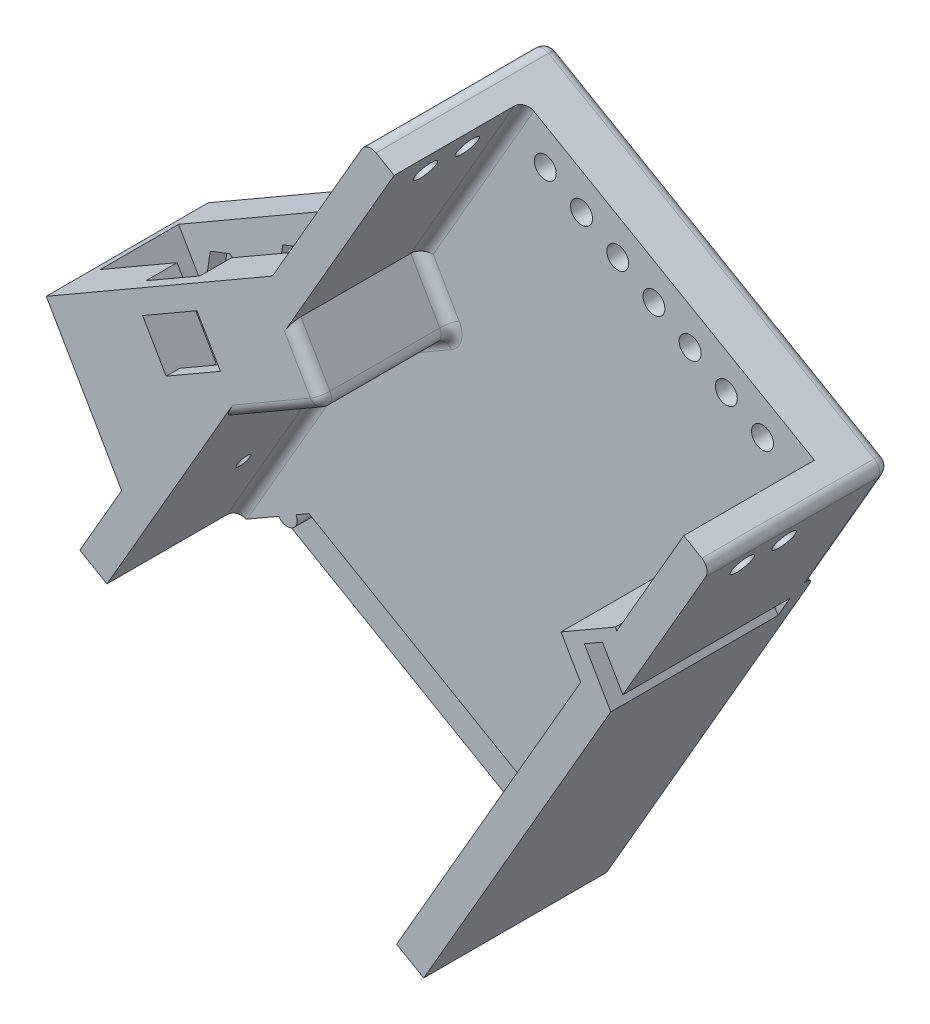
from build123d import *

# Parameters (mm, degrees)
SKETCH_2_W               = 109.92
SKETCH_2_H               = 76
EXTRUDE_1_DEPTH          = 10
CUT_EXTRUDE_1_DEPTH      = 5
SKETCH_4_R               = 2
CUT_EXTRUDE_2_DEPTH      = 92.808295873
SKETCH_5_W               = 109.92
SKETCH_5_H               = 6
EXTRUDE_2_DEPTH          = 25
CUT_EXTRUDE_3_DEPTH      = 104.340627651
CUT_EXTRUDE_3_DEPTH_BACK = 104.340627651
SKETCH_7_R               = 2.1
SKETCH_9_R               = 2.1
CUT_EXTRUDE_4_DEPTH      = 96.019804204
CUT_EXTRUDE_5_DEPTH      = 5
EXTRUDE_3_DEPTH          = 35
EXTRUDE_4_DEPTH          = 35
SKETCH_13_W              = 46
SKETCH_13_H              = 15
SKETCH_13_W_2            = 12
SKETCH_13_H_2            = 6
CUT_EXTRUDE_6_DEPTH      = 15
CUT_EXTRUDE_7_DEPTH      = 15
SKETCH_15_R              = 1.25
CUT_EXTRUDE_8_DEPTH      = 28.709519
EXTRUDE_5_DEPTH          = 35
CUT_EXTRUDE_10_DEPTH     = 4
CUT_EXTRUDE_11_REACH     = 116.42
SKETCH_22_R              = 2
CUT_EXTRUDE_12_DEPTH     = 3.5
CUT_EXTRUDE_14_REACH     = 117.568
EXTRUDE_6_DEPTH          = 3
EXTRUDE_7_REACH          = 117.568
SKETCH_27_W              = 4.526779154
SKETCH_27_H              = 4.806116501
FILLET_1_R               = 2
CUT_EXTRUDE_15_REACH     = 117.568
SKETCH_28_W              = 4.526779154
SKETCH_28_H              = 4.806116501


with BuildPart() as part:
    # 草圖2 → 填料-伸長1 (new body)
    with BuildSketch(Plane.XY):
        with Locations((12.52544527, 24.044160626)):
            Rectangle(SKETCH_2_W, SKETCH_2_H)
    extrude(amount=EXTRUDE_1_DEPTH)

    # 草圖3 → 除料-伸長1 (cut)
    with BuildSketch(Plane.XY.offset(10)):
        with BuildLine():
            Line((67.48544527, -6.055839374), (67.48544527, 54.144160626))
            Line((67.48544527, 54.144160626), (61.24181631, 50.538464901))
            ThreePointArc((61.24181631, 50.538464901), (61.408690367, 50.105080914), (61.46544527, 49.644160626))
            ThreePointArc((61.46544527, 49.644160626), (60.088104264, 47.81746208), (57.95299519, 48.639170705))
            Line((57.95299519, 48.639170705), (55.48544527, 47.214160626))
            Line((55.48544527, 47.214160626), (55.48544527, 0.874160626))
            Line((55.48544527, 0.874160626), (57.95299519, -0.550849453))
            ThreePointArc((57.95299519, -0.550849453), (60.088104264, 0.270859171), (61.46544527, -1.555839374))
            ThreePointArc((61.46544527, -1.555839374), (61.408690367, -2.016759663), (61.24181631, -2.45014365))
            Line((61.24181631, -2.45014365), (67.48544527, -6.055839374))
        make_face()
    extrude(amount=-CUT_EXTRUDE_1_DEPTH, mode=Mode.SUBTRACT)

    # 草圖4 → 除料-伸長2 (cut, through all)
    with BuildSketch(Plane.XY.offset(5)):
        with Locations((59.56544527, 41.644160626)):
            Circle(SKETCH_4_R)
        with Locations((59.56544527, 33.644160626)):
            Circle(SKETCH_4_R)
        with Locations((59.56544527, 6.444160626)):
            Circle(SKETCH_4_R)
        with Locations((59.56544527, 14.444160626)):
            Circle(SKETCH_4_R)
    extrude(amount=-CUT_EXTRUDE_2_DEPTH, mode=Mode.SUBTRACT)

    # 草圖5 → 填料-伸長2 (add)
    with BuildSketch(Plane.XY.offset(10)):
        with Locations((12.52544527, -10.955839374)):
            Rectangle(SKETCH_5_W, SKETCH_5_H)
        with Locations((12.52544527, 59.044160626)):
            Rectangle(SKETCH_5_W, SKETCH_5_H)
    extrude(amount=EXTRUDE_2_DEPTH)

    # 草圖7 → 除料-伸長3 (cut, two sides: drawn at the far end of the back side and taken through both)
    with BuildSketch(Plane(origin=(0, -7.955839374, 0), x_dir=(1, 0, 0), z_dir=(0, 1, 0)).offset(-CUT_EXTRUDE_3_DEPTH_BACK)):
        with Locations(Location((-36.43455473, -18, 0), (0, 0, 270))):
            Circle(SKETCH_7_R)
        with Locations(Location((-36.43455473, -26, 0), (0, 0, 270))):
            Circle(SKETCH_7_R)
    extrude(amount=CUT_EXTRUDE_3_DEPTH + CUT_EXTRUDE_3_DEPTH_BACK, mode=Mode.SUBTRACT)

    # 草圖9 → 除料-伸長4 (cut, through all)
    with BuildSketch(Plane.XY.offset(10)):
        with Locations((-36.43455473, 0.044160626)):
            Circle(SKETCH_9_R)
        with Locations((-36.43455473, 8.044160626)):
            Circle(SKETCH_9_R)
        with Locations((-36.43455473, 16.044160626)):
            Circle(SKETCH_9_R)
        with Locations((-36.43455473, 24.044160626)):
            Circle(SKETCH_9_R)
        with Locations((-36.43455473, 32.044160626)):
            Circle(SKETCH_9_R)
        with Locations((-36.43455473, 40.044160626)):
            Circle(SKETCH_9_R)
        with Locations((-36.43455473, 48.044160626)):
            Circle(SKETCH_9_R)
    extrude(amount=-CUT_EXTRUDE_4_DEPTH, mode=Mode.SUBTRACT)

    # 草圖10 → 除料-伸長5 (cut)
    with BuildSketch(Plane(origin=(0, 0, 0), x_dir=(-1, 0, 0), z_dir=(0, 0, -1))):
        with BuildLine():
            Line((32.43455473, 0.044160626), (32.43455473, 48.044160626))
            ThreePointArc((32.43455473, 48.044160626), (36.43455473, 52.044160626), (40.43455473, 48.044160626))
            Line((40.43455473, 48.044160626), (40.43455473, 0.044160626))
            ThreePointArc((40.43455473, 0.044160626), (36.43455473, -3.955839374), (32.43455473, 0.044160626))
        make_face()
    extrude(amount=-CUT_EXTRUDE_5_DEPTH, mode=Mode.SUBTRACT)

    # 草圖11 → 填料-伸長3 (add, through all)
    with BuildSketch(Plane.XY.offset(35)):
        Polygon((51.48544527, 62.044160626), (37.05168854, 87.044160626), (-6.249581649, 62.044160626), align=None)
    extrude(amount=-EXTRUDE_3_DEPTH)

    # 草圖12 → 填料-伸長4 (add)
    with BuildSketch(Plane.XY.offset(35)):
        Polygon((-6.249581649, 62.044160626), (37.05168854, 87.044160626), (47.05168854, 69.72365255), (3.750418351, 44.72365255), align=None)
    extrude(amount=-EXTRUDE_4_DEPTH)

    # 草圖13 → 除料-伸長6 (cut)
    with BuildSketch(Plane(origin=(-28.428305041, 49.239268705, 0), x_dir=(0.8660254037844416, 0.4999999999999949, 0), z_dir=(-0.4999999999999949, 0.8660254037844416, 0))):
        with Locations((50.609783842, -18.9)):
            Rectangle(SKETCH_13_W, SKETCH_13_H)
        with Locations((50.609783842, -29.4)):
            Rectangle(SKETCH_13_W_2, SKETCH_13_H_2)
    extrude(amount=-CUT_EXTRUDE_6_DEPTH, mode=Mode.SUBTRACT)

    # 草圖14 → 除料-伸長7 (cut)
    with BuildSketch(Plane(origin=(0, 0, 32.4), x_dir=(-1, 0, 0), z_dir=(0, 0, -1))):
        Polygon((-22.597205868, 74.080059011), (-27.097205868, 66.285830377), (-16.704901023, 60.285830377), (-12.204901023, 68.080059011), align=None)
    extrude(amount=-CUT_EXTRUDE_7_DEPTH, mode=Mode.SUBTRACT)

    # 草圖15 → 除料-伸長8 (cut)
    with BuildSketch(Plane(origin=(-20.928305041, 36.248887648, 0), x_dir=(0.8660254037844417, 0.4999999999999947, 0), z_dir=(-0.49999999999999484, 0.8660254037844418, 0))):
        with Locations(Location((69.109783842, -18.9, 0), (0, 0, 180))):
            Circle(SKETCH_15_R)
        with Locations(Location((32.109783842, -18.9, 0), (0, 0, 180))):
            Circle(SKETCH_15_R)
    extrude(amount=-CUT_EXTRUDE_8_DEPTH, mode=Mode.SUBTRACT)

    # 草圖18 → 填料-伸長5 (add)
    with BuildSketch(Plane.XY.offset(35)):
        Polygon((-13.593592417, -13.522826672), (-13.343592417, -13.955839374), (-8.724790263, -13.955839374), (-10.129490801, -11.522826672), align=None)
        Polygon((-17.093592417, -7.460648846), (-13.593592417, -13.522826672), (-10.129490801, -11.522826672), (-6.665389186, -9.522826672), (-3.201287571, -7.522826672), (-6.701287571, -1.460648846), align=None)
        Polygon((-3.201287571, -7.522826672), (-6.665389186, -9.522826672), (-4.10598811, -13.955839374), (0.512814044, -13.955839374), align=None)
    extrude(amount=-EXTRUDE_5_DEPTH)

    # 草圖21 → 除料-伸長10 (cut)
    with BuildSketch(Plane(origin=(0, 0, 0), x_dir=(-1, 0, 0), z_dir=(0, 0, -1))):
        Polygon((-37.05168854, 87.044160626), (-43.05168854, 76.65185578), (-51.48544527, 62.044160626), (-17.750418351, 62.044160626), (-11.750418351, 72.436465471), align=None)
    extrude(amount=-CUT_EXTRUDE_10_DEPTH, mode=Mode.SUBTRACT)

    # 草圖22 → 除料-伸長11 (cut, up to next)
    with BuildSketch(Plane(origin=(0, 0, 4), x_dir=(-1, 0, 0), z_dir=(0, 0, -1)), mode=Mode.PRIVATE) as cut_extrude_11_sk1:
        with Locations((-34.12348531, 76.115957396)):
            Circle(SKETCH_22_R)
    cut_extrude_11_tool1 = extrude(cut_extrude_11_sk1.sketch, amount=-CUT_EXTRUDE_11_REACH, mode=Mode.PRIVATE) & part.part
    # 草圖22 → 除料-伸長11 (cut, up to next)
    with BuildSketch(Plane(origin=(0, 0, 4), x_dir=(-1, 0, 0), z_dir=(0, 0, -1)), mode=Mode.PRIVATE) as cut_extrude_11_sk2:
        with Locations((-20.267078849, 68.115957396)):
            Circle(SKETCH_22_R)
    cut_extrude_11_tool2 = extrude(cut_extrude_11_sk2.sketch, amount=-CUT_EXTRUDE_11_REACH, mode=Mode.PRIVATE) & part.part
    add(cut_extrude_11_tool1.solids().sort_by_distance((34.123485, 76.115957, 4))[0], mode=Mode.SUBTRACT)
    add(cut_extrude_11_tool2.solids().sort_by_distance((20.267079, 68.115957, 4))[0], mode=Mode.SUBTRACT)

    # 草圖23 → 除料-伸長12 (cut)
    with BuildSketch(Plane.XY.offset(11.4)):
        Polygon((16.539589727, 69.567103439), (17.14660495, 65.613430145), (20.874094073, 64.162284101), (23.994567972, 66.664811352), (23.387552749, 70.618484646), (19.660063626, 72.06963069), align=None)
        Polygon((30.395996187, 77.567103439), (31.00301141, 73.613430145), (34.730500533, 72.162284101), (37.850974433, 74.664811352), (37.24395921, 78.618484646), (33.516470087, 80.06963069), align=None)
    extrude(amount=-CUT_EXTRUDE_12_DEPTH, mode=Mode.SUBTRACT)

    # 草圖24 → 除料-伸長14 (cut, up to next)
    with BuildSketch(Plane.XY.offset(35), mode=Mode.PRIVATE) as cut_extrude_14_sk1:
        Polygon((-7.570089725, -15.955839374), (-4.10598811, -13.955839374), (-9.165389186, -5.192699653), (-12.629490801, -7.192699653), align=None)
    cut_extrude_14_tool1 = extrude(cut_extrude_14_sk1.sketch, amount=-CUT_EXTRUDE_14_REACH, mode=Mode.PRIVATE) & part.part
    add(cut_extrude_14_tool1.solids().sort_by_distance((-8.367739, -10.57427, 35))[0], mode=Mode.SUBTRACT)

    # 草圖25 → 填料-伸長6 (add)
    with BuildSketch(Plane(origin=(0, 0, 0), x_dir=(-1, 0, 0), z_dir=(0, 0, -1))):
        Polygon((8.724790263, -13.955839374), (4.10598811, -13.955839374), (9.165389186, -5.192699653), (12.629490801, -7.192699653), align=None)
    extrude(amount=-EXTRUDE_6_DEPTH)

    # 填料-伸長7: up to this face of the body (flat: up to its plane)
    extrude_7_end = Plane(part.part.faces().sort_by_distance((14.81484306, 24.690999313, 0))[0])
    # 草圖27 → 填料-伸長7 (add, up to the picked face)
    with BuildSketch(Plane.XY.offset(35), mode=Mode.PRIVATE) as extrude_7_sk1:
        with Locations((-9.842598533, -16.358897625)):
            Rectangle(SKETCH_27_W, SKETCH_27_H)
    extrude_7_tool1 = split(extrude(extrude_7_sk1.sketch, amount=-EXTRUDE_7_REACH, mode=Mode.PRIVATE), bisect_by=extrude_7_end, keep=Keep.BOTH, mode=Mode.PRIVATE)
    add(extrude_7_tool1.solids().sort_by(Axis((-9.842599, -16.358898, 35), (0, 0, -1)))[0])

    # 圓角1
    fillet_1_edges = [part.edges().sort_by_distance(p)[0] for p in [
        (-24.34206819, 62.044160626, 0),
        (-6.249581649, 62.044160626, 17.5),
        (45.421779388, 56.044160626, 10),
        (0.482469159, 50.383906588, 10),
        (13.554265928, 50.383906588, 10),
        (3.750418351, 44.72365255, 22.5),
        (0.482469159, 50.383906588, 35),
        (13.554265928, 50.383906588, 35),
        (2.750418351, 67.240313048, 0),
        (-12.10598811, -16.358897625, 0),
        (-27.27027142, -13.955839374, 0),
        (32.267078849, -7.955839374, 10),
        (-42.43455473, 24.044160626, 0),
        (-22.610017382, 56.044160626, 10),
        (-42.43455473, 62.044160626, 17.5),
        (-42.43455473, -13.955839374, 17.5),
    ]]
    fillet(fillet_1_edges, radius=FILLET_1_R - 0.0001)  # a hair under: the kernel refuses the full size

    # 草圖28 → 除料-伸長15 (cut, up to next)
    with BuildSketch(Plane.XY.offset(35), mode=Mode.PRIVATE) as cut_extrude_15_sk1:
        with Locations((-9.842598533, -16.358897625)):
            Rectangle(SKETCH_28_W, SKETCH_28_H)
    cut_extrude_15_tool1 = extrude(cut_extrude_15_sk1.sketch, amount=-CUT_EXTRUDE_15_REACH, mode=Mode.PRIVATE) & part.part
    add(cut_extrude_15_tool1.solids().sort_by_distance((-9.842599, -16.358898, 35))[0], mode=Mode.SUBTRACT)


with BuildPart() as body_2:
    # 鏡射1: mirrored copy
    add(part.part.mirror(Plane(origin=(51.48544527, 62.044160626, 0), x_dir=(0, 0, 1), z_dir=(0.8660254037844434, 0.4999999999999917, 0))))


solid = body_2.part
